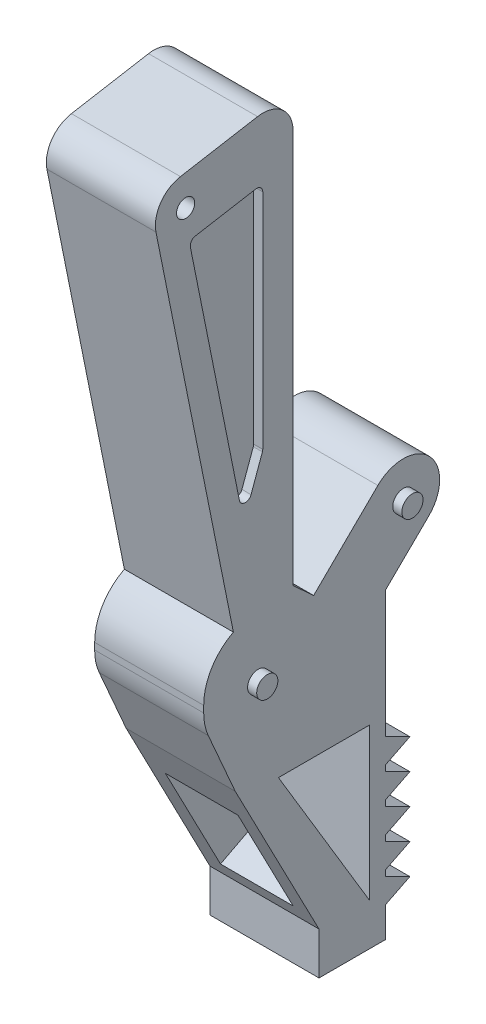
from build123d import *

# Parameters (mm, degrees)
BOSS_EXTRUDE1_DEPTH     = 9
CUT_EXTRUDE1_DEPTH      = 116.769079262
CUT_EXTRUDE1_DEPTH_BACK = 116.769079262
BOSS_EXTRUDE2_DEPTH     = 18
LPATTERN1_COUNT         = 5
LPATTERN1_PITCH         = 5
FILLET1_R               = 9
FILLET2_R               = 5
SKETCH5_R               = 1.5
CUT_EXTRUDE2_DEPTH      = 25
CUT_EXTRUDE3_REACH      = 94.43
SKETCH8_W               = 12
SKETCH8_H               = 19.757506074
SKETCH9_R               = 1.75
BOSS_EXTRUDE3_DEPTH     = 1.5
SKETCH10_R              = 1.75
BOSS_EXTRUDE4_DEPTH     = 1.5
CUT_EXTRUDE5_DEPTH      = 1.5


with BuildPart() as part:
    # Sketch1 → Boss-Extrude1 (new, symmetric)
    with BuildSketch(Plane(origin=(0, 0, 0), x_dir=(0, 0, -1), z_dir=(1, 0, 0))):
        Polygon((64.03845405, 1.736481777), (54.19037652, 0), (40.392944784, 68.626750451), (64.03845405, 72.736481777), align=None)
        with BuildLine():
            Line((79.326468903, -6.518014035), (86.456160579, 0.493939802))
            ThreePointArc((86.456160579, 0.493939802), (86.526803283, 8.978927109), (78.041815975, 9.049569813))
            Line((78.041815975, 9.049569813), (67.436419126, -1.380692322))
            Line((67.436419126, -1.380692322), (64.03845405, 1.736481777))
            Line((64.03845405, 1.736481777), (54.19037652, 0))
            Line((54.19037652, 0), (49.287534486, -0.985718074))
            Line((49.287534486, -0.985718074), (49.287534486, -10.985718074))
            Line((49.287534486, -10.985718074), (54.49039716, -22.899165098))
            Line((54.49039716, -22.899165098), (68.326468903, -49.518014035))
            Line((68.326468903, -49.518014035), (68.326468903, -56.518014035))
            Line((68.326468903, -56.518014035), (79.326468903, -56.518014035))
            Line((79.326468903, -56.518014035), (79.326468903, -6.518014035))
        make_face()
    extrude(amount=BOSS_EXTRUDE1_DEPTH, both=True)

    # Sketch3 → Cut-Extrude1 (cut, two sides: drawn at the far end of the back side and taken through both)
    with BuildSketch(Plane(origin=(9, 0, 0), x_dir=(0, 0, -1), z_dir=(1, 0, 0)).offset(-CUT_EXTRUDE1_DEPTH_BACK)):
        Polygon((76.626468903, -49.518014035), (76.626468903, -24.518014035), (61.626468903, -24.518014035), align=None)
    extrude(amount=CUT_EXTRUDE1_DEPTH + CUT_EXTRUDE1_DEPTH_BACK, mode=Mode.SUBTRACT)

    # Sketch4 → Boss-Extrude2 (add)
    with BuildSketch(Plane(origin=(9, 0, 0), x_dir=(0, 0, -1), z_dir=(1, 0, 0))):
        Polygon((83.326468903, -49.518014035), (79.326468903, -49.518014035), (79.326468903, -51.518014035), align=None)
        Polygon((79.326468903, -47.518014035), (79.326468903, -49.518014035), (83.326468903, -49.518014035), align=None)
    boss_extrude2 = extrude(amount=-BOSS_EXTRUDE2_DEPTH)

    # LPattern1: Boss-Extrude2 ×5
    with Locations(*[(0, i * LPATTERN1_PITCH, 0) for i in range(1, LPATTERN1_COUNT)]):
        add(boss_extrude2)

    # Fillet1
    # the kernel refuses this fillet: 9 mm, written as the material it takes off along each edge
    with BuildSketch(Plane(origin=(-13.698844365, -10.985718074, -49.287534486), x_dir=(0, -0.9164190018423571, -0.4002202057146263), z_dir=(1, 0, 0))) as fillet1_piece_1:
        with BuildLine():
            CenterArc((FILLET1_R * 0.208837527352, FILLET1_R), FILLET1_R, 246.408054679, 23.591945321)
            Line((-FILLET1_R * 0.191382678363, FILLET1_R * 0.0835809981576), (-FILLET1_R * 0.199387082477, FILLET1_R * 0.0652526181208))
            Line((-FILLET1_R * 0.199387082477, FILLET1_R * 0.0652526181208), (-FILLET1_R * 0.00417675054703, -FILLET1_R * 0.02))
            Line((-FILLET1_R * 0.00417675054703, -FILLET1_R * 0.02), (FILLET1_R * 0.208837527352, -FILLET1_R * 0.02))
            Line((FILLET1_R * 0.208837527352, -FILLET1_R * 0.02), (FILLET1_R * 0.208837527352, 0))
        make_face()
    extrude(amount=27.397688731, mode=Mode.SUBTRACT)
    with BuildSketch(Plane(origin=(-26.569004687, -0.985718074, -49.287534486), x_dir=(0, -1, 0), z_dir=(1, 0, 0))) as fillet1_piece_2:
        with BuildLine():
            CenterArc((7.027601875, 9), FILLET1_R, 207.080362773, 62.919637227)
            Line((-0.985718074, 4.902842034), (-1.145984473, 4.820898874))
            ThreePointArc((-1.145984473, 4.820898874), (-0.669327824, 2.415941907), (-0.176468787, -0.03547911))
            Line((-0.176468787, -0.03547911), (0, -0.18))
            Line((0, -0.18), (7.027601875, -0.18))
            Line((7.027601875, -0.18), (7.027601875, 0))
        make_face()
    extrude(amount=53.138009374, mode=Mode.SUBTRACT)

    # Fillet2
    fillet2_edges = [part.edges().sort_by_distance(p)[0] for p in [
        (0, 68.626750451, -40.392944784),
        (0, 72.736481777, -64.03845405),
    ]]
    fillet(fillet2_edges, radius=FILLET2_R)

    # Sketch5 → Cut-Extrude2 (cut)
    with BuildSketch(Plane(origin=(9, 0, 0), x_dir=(0, 0, -1), z_dir=(1, 0, 0))):
        with Locations((46.306671362, 64.579632178)):
            Circle(SKETCH5_R)
    extrude(amount=-CUT_EXTRUDE2_DEPTH, mode=Mode.SUBTRACT)

    # Cut-Extrude3: up to this plane
    cut_extrude3_end = Plane(origin=(-9, -24.518014035, -61.626468903), z_dir=(0, -0.5144957554275262, 0.8574929257125444))
    # Sketch8 → Cut-Extrude3 (cut, up to the surface)
    with BuildSketch(Plane(origin=(0, 17.427872297, -33.529018106), x_dir=(1, 0, 0), z_dir=(0, -0.4612023914177088, 0.8872949645696107)), mode=Mode.PRIVATE) as cut_extrude3_sk1:
        with Locations((0, -62.828168401)):
            Rectangle(SKETCH8_W, SKETCH8_H)
    cut_extrude3_tool1 = split(extrude(cut_extrude3_sk1.sketch, amount=-CUT_EXTRUDE3_REACH, mode=Mode.PRIVATE), bisect_by=cut_extrude3_end, keep=Keep.BOTH, mode=Mode.PRIVATE)
    add(cut_extrude3_tool1.solids().sort_by_distance((0, -38.319245, -62.50552))[0], mode=Mode.SUBTRACT)

    # Sketch9 → Boss-Extrude3 (add)
    with BuildSketch(Plane(origin=(9, 0, 0), x_dir=(0, 0, -1), z_dir=(1, 0, 0))):
        with Locations((82.248988277, 4.771754807)):
            Circle(SKETCH9_R)
    boss_extrude3 = extrude(amount=BOSS_EXTRUDE3_DEPTH)

    # Sketch10 → Boss-Extrude4 (add)
    with BuildSketch(Plane(origin=(9, 0, 0), x_dir=(0, 0, -1), z_dir=(1, 0, 0))):
        with Locations((58.287534486, -9.106180328)):
            Circle(SKETCH10_R)
    boss_extrude4 = extrude(amount=BOSS_EXTRUDE4_DEPTH)

    # Sketch11 → Cut-Extrude5 (cut)
    with BuildSketch(Plane(origin=(9, 0, 0), x_dir=(0, 0, -1), z_dir=(1, 0, 0))):
        with BuildLine():
            Line((59.03845405, 60.528735066), (59.03845405, 23.717958421))
            ThreePointArc((59.03845405, 23.717958421), (59.023347404, 23.544796412), (58.978483887, 23.376866197))
            Line((58.978483887, 23.376866197), (57.101026027, 18.202704248))
            ThreePointArc((57.101026027, 18.202704248), (56.086229397, 17.546595426), (55.180614041, 18.346690305))
            Line((55.180614041, 18.346690305), (47.087922198, 58.598757084))
            ThreePointArc((47.087922198, 58.598757084), (47.2430546, 59.360631218), (47.897065542, 59.781092804))
            Line((47.897065542, 59.781092804), (57.867215244, 61.513964619))
            ThreePointArc((57.867215244, 61.513964619), (58.682178057, 61.293992802), (59.03845405, 60.528735066))
        make_face()
    cut_extrude5 = extrude(amount=-CUT_EXTRUDE5_DEPTH, mode=Mode.SUBTRACT)

    # Mirror1: Cut-Extrude5 across plane
    add(cut_extrude5.mirror(Plane(origin=(0, 0, 0), x_dir=(0, 0, 1), z_dir=(1, 0, 0))), mode=Mode.SUBTRACT)

    # Mirror2: Boss-Extrude3, Boss-Extrude4 across plane
    add(boss_extrude3.mirror(Plane(origin=(0, 0, 0), x_dir=(0, 0, 1), z_dir=(1, 0, 0))))
    add(boss_extrude4.mirror(Plane(origin=(0, 0, 0), x_dir=(0, 0, 1), z_dir=(1, 0, 0))))


solid = part.part
